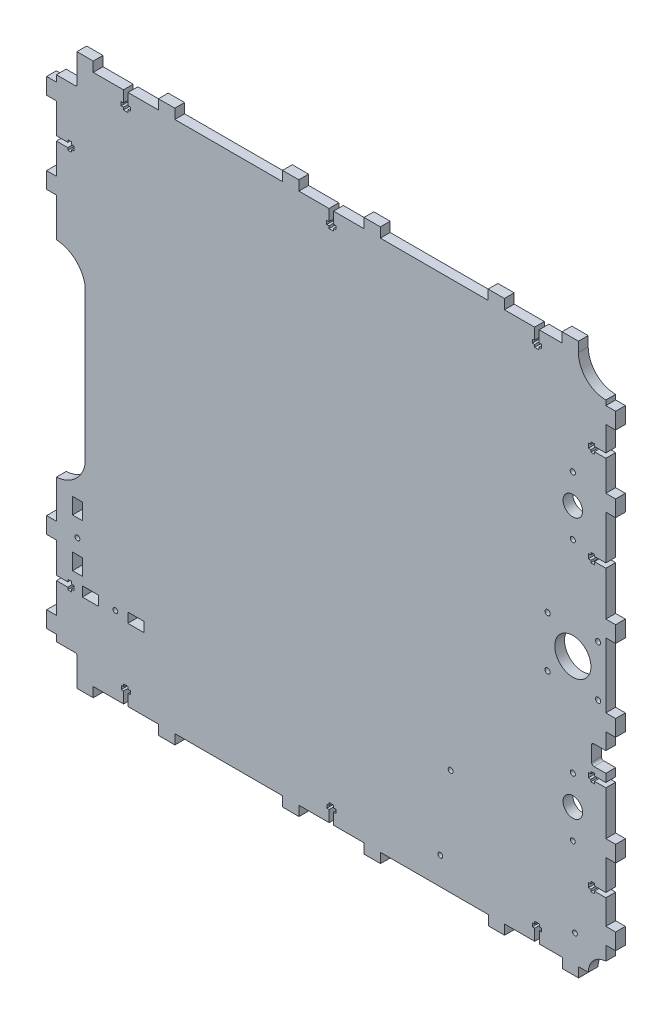
from build123d import *

# Parameters (mm, degrees)
SKETCH_1_R      = 6
SKETCH_1_R_2    = 1.6
SKETCH_1_R_3    = 1.55
SKETCH_1_R_4    = 11.1
SKETCH_1_R_5    = 1.5
SKETCH_1_W      = 9.9
SKETCH_1_H      = 6
SKETCH_1_W_2    = 6
SKETCH_1_H_2    = 9.9
EXTRUDE_1_DEPTH = 6


with BuildPart() as part:
    # Эскиз1 → Бобышка-Вытянуть1 (new body)
    with BuildSketch(Plane.XY):
        with BuildLine():
            Line((168.199310706, -52.298122462), (168.199310706, -57.218125343))
            Line((168.199310706, -57.218125343), (161.199309499, -57.218125343))
            Line((161.199309499, -57.218125343), (161.199309499, -55.815811247))
            Line((161.199309499, -55.815811247), (158.998486916, -55.815811247))
            Line((158.998486916, -55.815811247), (158.999308988, -57.215692211))
            Line((158.999308988, -57.215692211), (157.499309247, -57.216573077))
            Line((157.499309247, -57.216573077), (157.500952992, -60.015655883))
            Line((157.500952992, -60.015655883), (159.000952734, -60.014775017))
            Line((159.000952734, -60.014775017), (159.001775414, -61.415692272))
            Line((159.001775414, -61.415692272), (161.202727499, -61.415745636))
            Line((161.202727499, -61.415745636), (161.202286063, -60.018125343))
            Line((161.202286063, -60.018125343), (168.199310706, -60.018125343))
            Line((168.199310706, -60.018125343), (168.199310706, -87.018125343))
            Line((168.199310706, -87.018125343), (174.199310706, -87.018125343))
            Line((174.199310706, -87.018125343), (174.199310706, -97.018125338))
            Line((174.199310706, -97.018125338), (168.199310706, -97.018125338))
            Line((168.199310706, -97.018125338), (168.199310706, -115.618125338))
            Line((168.199310706, -115.618125338), (161.199752595, -115.618125338))
            Line((161.199752595, -115.618125338), (161.199752595, -114.216834131))
            Line((161.199752595, -114.216834131), (158.998486916, -114.216834131))
            Line((158.998486916, -114.216834131), (158.999308988, -115.616715096))
            Line((158.999308988, -115.616715096), (157.499309247, -115.617595962))
            Line((157.499309247, -115.617595962), (157.500952992, -118.416678768))
            Line((157.500952992, -118.416678768), (159.000952734, -118.415797902))
            Line((159.000952734, -118.415797902), (159.001775414, -119.816715157))
            Line((159.001775414, -119.816715157), (161.202113772, -119.816768506))
            Line((161.202113772, -119.816768506), (161.201876481, -118.418125338))
            Line((161.201876481, -118.418125338), (168.199310706, -118.418125338))
            Line((168.199310706, -118.418125338), (168.199310706, -133.598125338))
            Line((168.199310706, -133.598125338), (174.199310706, -133.598125338))
            Line((174.199310706, -133.598125338), (174.199310706, -143.598125338))
            Line((174.199310706, -143.598125338), (168.199310706, -143.598125338))
            Line((168.199310706, -143.598125338), (168.199310706, -152.12715677))
            ThreePointArc((168.199310706, -152.12715677), (160.572403694, -155.612835394), (157.456488656, -163.398125338))
            Line((157.456488656, -163.398125338), (151.456488656, -163.398125338))
            Line((151.456488656, -163.398125338), (151.472639331, -169.398125338))
            Line((151.472639331, -169.398125338), (141.464563993, -169.398125338))
            Line((141.464563993, -169.398125338), (141.464563993, -163.398125338))
            Line((141.464563993, -163.398125338), (127.366900433, -163.398125338))
            Line((127.366900433, -163.398125338), (127.365710498, -156.400624402))
            Line((127.365710498, -156.400624402), (128.765710498, -156.400590458))
            Line((128.765710498, -156.400590458), (128.765657157, -154.200590047))
            Line((128.765657157, -154.200590047), (127.364739902, -154.199767366))
            Line((127.364739902, -154.199767366), (127.365620769, -152.699767625))
            Line((127.365620769, -152.699767625), (124.566537963, -152.69812388))
            Line((124.566537963, -152.69812388), (124.565657096, -154.198123621))
            Line((124.565657096, -154.198123621), (123.165776132, -154.197301549))
            Line((123.165776132, -154.197301549), (123.165776132, -156.398124131))
            Line((123.165776132, -156.398124131), (124.565880156, -156.398124131))
            Line((124.565880156, -156.398124131), (124.565880156, -163.398125338))
            Line((124.565880156, -163.398125338), (106.088846345, -163.398125338))
            Line((106.088846345, -163.398125338), (106.088846345, -169.398125338))
            Line((106.088846345, -169.398125338), (96.088846345, -169.398125338))
            Line((96.088846345, -169.398125338), (96.088846345, -163.398125338))
            Line((96.088846345, -163.398125338), (30.000827623, -163.398125338))
            Line((30.000827623, -163.398125338), (30.000827623, -169.398125338))
            Line((30.000827623, -169.398125338), (20.000827623, -169.398125338))
            Line((20.000827623, -169.398125338), (20.000827623, -163.398125338))
            Line((20.000827623, -163.398125338), (1.304671492, -163.398125338))
            Line((1.304671492, -163.398125338), (1.303481557, -156.400624402))
            Line((1.303481557, -156.400624402), (2.703481557, -156.400590458))
            Line((2.703481557, -156.400590458), (2.703428216, -154.200590047))
            Line((2.703428216, -154.200590047), (1.302510961, -154.199767366))
            Line((1.302510961, -154.199767366), (1.303391828, -152.699767625))
            Line((1.303391828, -152.699767625), (-1.495690978, -152.69812388))
            Line((-1.495690978, -152.69812388), (-1.496571845, -154.198123621))
            Line((-1.496571845, -154.198123621), (-2.896452809, -154.197301549))
            Line((-2.896452809, -154.197301549), (-2.896452809, -156.398124131))
            Line((-2.896452809, -156.398124131), (-1.496348785, -156.398124131))
            Line((-1.496348785, -156.398124131), (-1.496348785, -163.398125338))
            Line((-1.496348785, -163.398125338), (-19.996163846, -163.398125338))
            Line((-19.996163846, -163.398125338), (-19.996163846, -169.398125338))
            Line((-19.996163846, -169.398125338), (-29.996163846, -169.398125338))
            Line((-29.996163846, -169.398125338), (-29.996163846, -163.398125338))
            Line((-29.996163846, -163.398125338), (-96.08209646, -163.398125338))
            Line((-96.08209646, -163.398125338), (-96.08209646, -169.398125338))
            Line((-96.08209646, -169.398125338), (-106.08209646, -169.398125338))
            Line((-106.08209646, -169.398125338), (-106.08209646, -163.398125338))
            Line((-106.08209646, -163.398125338), (-124.75810764, -163.398125338))
            Line((-124.75810764, -163.398125338), (-124.759297575, -156.400624402))
            Line((-124.759297575, -156.400624402), (-123.359297576, -156.400590458))
            Line((-123.359297576, -156.400590458), (-123.359350916, -154.200590047))
            Line((-123.359350916, -154.200590047), (-124.760268171, -154.199767366))
            Line((-124.760268171, -154.199767366), (-124.759387305, -152.699767625))
            Line((-124.759387305, -152.699767625), (-127.558470111, -152.69812388))
            Line((-127.558470111, -152.69812388), (-127.559350977, -154.198123621))
            Line((-127.559350977, -154.198123621), (-128.959231942, -154.197301549))
            Line((-128.959231942, -154.197301549), (-128.959231942, -156.398124131))
            Line((-128.959231942, -156.398124131), (-127.559127917, -156.398124131))
            Line((-127.559127917, -156.398124131), (-127.559127917, -163.398125338))
            Line((-127.559127917, -163.398125338), (-146.195092631, -163.398125338))
            Line((-146.195092631, -163.398125338), (-146.195092631, -169.398125338))
            Line((-146.195092631, -169.398125338), (-156.195092631, -169.398125338))
            Line((-156.195092631, -169.398125338), (-156.195092631, -151.950559202))
            ThreePointArc((-156.195092631, -151.950559202), (-156.443252823, -151.291213387), (-157.064566439, -150.959114341))
            Line((-157.064566439, -150.959114341), (-157.195092631, -150.950559202))
            Line((-157.195092631, -150.950559202), (-168.800689294, -150.950559202))
            Line((-168.800689294, -150.950559202), (-168.800689294, -146.938125338))
            Line((-168.800689294, -146.938125338), (-174.800689294, -146.938125338))
            Line((-174.800689294, -146.938125338), (-174.800689294, -136.938125338))
            Line((-174.800689294, -136.938125338), (-168.800689294, -136.938125338))
            Line((-168.800689294, -136.938125338), (-168.800689294, -118.438125338))
            Line((-168.800689294, -118.438125338), (-161.800688087, -118.438125338))
            Line((-161.800688087, -118.438125338), (-161.800688087, -119.838229363))
            Line((-161.800688087, -119.838229363), (-159.599865505, -119.838229363))
            Line((-159.599865505, -119.838229363), (-159.600686983, -118.439360374))
            Line((-159.600686983, -118.439360374), (-158.100196827, -118.43847922))
            Line((-158.100196827, -118.43847922), (-158.095498836, -115.637580558))
            Line((-158.095498836, -115.637580558), (-159.602331088, -115.638721675))
            Line((-159.602331088, -115.638721675), (-159.603391996, -114.237804581))
            Line((-159.603391996, -114.237804581), (-161.803392384, -114.238125353))
            Line((-161.803392384, -114.238125353), (-161.803188256, -115.638125338))
            Line((-161.803188256, -115.638125338), (-168.800689294, -115.638125338))
            Line((-168.800689294, -115.638125338), (-168.800689294, -96.918125338))
            Line((-168.800689294, -96.918125338), (-174.800689294, -96.918125338))
            Line((-174.800689294, -96.918125338), (-174.800689294, -86.918125338))
            Line((-174.800689294, -86.918125338), (-168.800689294, -86.918125338))
            Line((-168.800689294, -86.918125338), (-168.800689294, -63.480258903))
            ThreePointArc((-168.800689294, -63.480258903), (-157.388702527, -58.725695754), (-151.244839154, -47.997589884))
            Line((-151.244839154, -47.997589884), (-151.272354325, 47.500944109))
            ThreePointArc((-151.272354325, 47.500944109), (-157.419219349, 58.082787741), (-168.800689294, 62.579620646))
            Line((-168.800689294, 62.579620646), (-168.800689294, 86.321874662))
            Line((-168.800689294, 86.321874662), (-174.800689294, 86.321874662))
            Line((-174.800689294, 86.321874662), (-174.800689294, 96.321874662))
            Line((-174.800689294, 96.321874662), (-168.800689294, 96.321874662))
            Line((-168.800689294, 96.321874662), (-168.800689294, 115.041874662))
            Line((-168.800689294, 115.041874662), (-161.800688087, 115.041874662))
            Line((-161.800688087, 115.041874662), (-161.800688087, 113.641770637))
            Line((-161.800688087, 113.641770637), (-159.599865505, 113.641770637))
            Line((-159.599865505, 113.641770637), (-159.600687577, 115.041651602))
            Line((-159.600687577, 115.041651602), (-158.100210407, 115.042532748))
            Line((-158.100210407, 115.042532748), (-158.102330745, 117.842414269))
            Line((-158.102330745, 117.842414269), (-159.602331088, 117.841278325))
            Line((-159.602331088, 117.841278325), (-159.603391996, 119.242195419))
            Line((-159.603391996, 119.242195419), (-161.803392384, 119.241874647))
            Line((-161.803392384, 119.241874647), (-161.803188256, 117.841874662))
            Line((-161.803188256, 117.841874662), (-168.800689294, 117.841874662))
            Line((-168.800689294, 117.841874662), (-168.800689294, 136.341874662))
            Line((-168.800689294, 136.341874662), (-174.800689294, 136.341874662))
            Line((-174.800689294, 136.341874662), (-174.800689294, 146.341874662))
            Line((-174.800689294, 146.341874662), (-168.800689294, 146.341874662))
            Line((-168.800689294, 146.341874662), (-168.800689294, 150.22196022))
            Line((-168.800689294, 150.22196022), (-157.195092631, 150.22196022))
            ThreePointArc((-157.195092631, 150.22196022), (-156.48798585, 150.514853439), (-156.195092631, 151.22196022))
            Line((-156.195092631, 151.22196022), (-156.195092631, 168.801874662))
            Line((-156.195092631, 168.801874662), (-146.195092631, 168.801874662))
            Line((-146.195092631, 168.801874662), (-146.195092631, 162.801874662))
            Line((-146.195092631, 162.801874662), (-127.654444614, 162.801874662))
            Line((-127.654444614, 162.801874662), (-127.654444614, 155.801873455))
            Line((-127.654444614, 155.801873455), (-129.054548638, 155.801873455))
            Line((-129.054548638, 155.801873455), (-129.054548638, 153.601050872))
            Line((-129.054548638, 153.601050872), (-127.654667673, 153.601872944))
            Line((-127.654667673, 153.601872944), (-127.653786807, 152.101873203))
            Line((-127.653786807, 152.101873203), (-124.854704001, 152.103516948))
            Line((-124.854704001, 152.103516948), (-124.855584867, 153.60351669))
            Line((-124.855584867, 153.60351669), (-123.454667612, 153.60433937))
            Line((-123.454667612, 153.60433937), (-123.454614272, 155.804339781))
            Line((-123.454614272, 155.804339781), (-124.854614272, 155.804373725))
            Line((-124.854614272, 155.804373725), (-124.853424337, 162.801874662))
            Line((-124.853424337, 162.801874662), (-106.177413157, 162.801874662))
            Line((-106.177413157, 162.801874662), (-106.177413157, 168.801874662))
            Line((-106.177413157, 168.801874662), (-96.177413157, 168.801874662))
            Line((-96.177413157, 168.801874662), (-96.177413157, 162.801874662))
            Line((-96.177413157, 162.801874662), (-30.091480542, 162.801874662))
            Line((-30.091480542, 162.801874662), (-30.091480542, 168.801874662))
            Line((-30.091480542, 168.801874662), (-20.091480542, 168.801874662))
            Line((-20.091480542, 168.801874662), (-20.091480542, 162.801874662))
            Line((-20.091480542, 162.801874662), (-1.591665481, 162.801874662))
            Line((-1.591665481, 162.801874662), (-1.591665481, 155.801873455))
            Line((-1.591665481, 155.801873455), (-2.991769506, 155.801873455))
            Line((-2.991769506, 155.801873455), (-2.991769506, 153.601050872))
            Line((-2.991769506, 153.601050872), (-1.591888541, 153.601872944))
            Line((-1.591888541, 153.601872944), (-1.591007675, 152.101873203))
            Line((-1.591007675, 152.101873203), (1.208075131, 152.103516948))
            Line((1.208075131, 152.103516948), (1.207194265, 153.60351669))
            Line((1.207194265, 153.60351669), (2.60811152, 153.60433937))
            Line((2.60811152, 153.60433937), (2.60816486, 155.804339781))
            Line((2.60816486, 155.804339781), (1.208164861, 155.804373725))
            Line((1.208164861, 155.804373725), (1.209354796, 162.801874662))
            Line((1.209354796, 162.801874662), (19.905510926, 162.801874662))
            Line((19.905510926, 162.801874662), (19.905510926, 168.801874662))
            Line((19.905510926, 168.801874662), (29.905510926, 168.801874662))
            Line((29.905510926, 168.801874662), (29.905510926, 162.801874662))
            Line((29.905510926, 162.801874662), (95.993529648, 162.801874662))
            Line((95.993529648, 162.801874662), (95.993529648, 168.801874662))
            Line((95.993529648, 168.801874662), (105.993529648, 168.801874662))
            Line((105.993529648, 168.801874662), (105.993529648, 162.801874662))
            Line((105.993529648, 162.801874662), (124.47056346, 162.801874662))
            Line((124.47056346, 162.801874662), (124.47056346, 155.801873455))
            Line((124.47056346, 155.801873455), (123.070459435, 155.801873455))
            Line((123.070459435, 155.801873455), (123.070459435, 153.601050872))
            Line((123.070459435, 153.601050872), (124.4703404, 153.601872944))
            Line((124.4703404, 153.601872944), (124.471221266, 152.101873203))
            Line((124.471221266, 152.101873203), (127.270304072, 152.103516948))
            Line((127.270304072, 152.103516948), (127.269423206, 153.60351669))
            Line((127.269423206, 153.60351669), (128.670340461, 153.60433937))
            Line((128.670340461, 153.60433937), (128.670393801, 155.804339781))
            Line((128.670393801, 155.804339781), (127.270393802, 155.804373725))
            Line((127.270393802, 155.804373725), (127.271583737, 162.801874662))
            Line((127.271583737, 162.801874662), (141.377322634, 162.801874662))
            Line((141.377322634, 162.801874662), (141.377322634, 168.801874662))
            Line((141.377322634, 168.801874662), (151.377322634, 168.801874662))
            Line((151.377322634, 168.801874662), (151.377322634, 162.801874662))
            ThreePointArc((151.377322634, 162.801874662), (156.304368867, 150.906932823), (168.199310706, 145.97988659))
            Line((168.199310706, 145.97988659), (168.199310706, 143.001874662))
            Line((168.199310706, 143.001874662), (174.199310706, 143.001874662))
            Line((174.199310706, 143.001874662), (174.199310706, 133.001874662))
            Line((174.199310706, 133.001874662), (168.199310706, 133.001874662))
            Line((168.199310706, 133.001874662), (168.199310706, 117.821874662))
            Line((168.199310706, 117.821874662), (161.198884876, 117.821874662))
            Line((161.198884876, 117.821874662), (161.198672593, 119.221937544))
            Line((161.198672593, 119.221937544), (158.997850029, 119.221603845))
            Line((158.997850029, 119.221603845), (158.998884357, 117.821723022))
            Line((158.998884357, 117.821723022), (157.498884767, 117.820614719))
            Line((157.498884767, 117.820614719), (157.500952921, 115.021532194))
            Line((157.500952921, 115.021532194), (159.000952512, 115.022640497))
            Line((159.000952512, 115.022640497), (159.001987605, 113.621723383))
            Line((159.001987605, 113.621723383), (161.202013777, 113.622003619))
            Line((161.202013777, 113.622003619), (161.201809668, 115.021874662))
            Line((161.201809668, 115.021874662), (168.199310706, 115.021874662))
            Line((168.199310706, 115.021874662), (168.199310706, 96.421874662))
            Line((168.199310706, 96.421874662), (174.199310706, 96.421874662))
            Line((174.199310706, 96.421874662), (174.199310706, 86.421874662))
            Line((174.199310706, 86.421874662), (168.199310706, 86.421874662))
            Line((168.199310706, 86.421874662), (168.199310706, 59.421874662))
            Line((168.199310706, 59.421874662), (161.199309232, 59.421874662))
            Line((161.199309232, 59.421874662), (161.199309232, 60.476838077))
            Line((161.199309232, 60.476838077), (158.998486738, 60.476838077))
            Line((158.998486738, 60.476838077), (158.99930881, 59.076957113))
            Line((158.99930881, 59.076957113), (157.499309069, 59.076076247))
            Line((157.499309069, 59.076076247), (157.500952814, 56.276993441))
            Line((157.500952814, 56.276993441), (159.000952556, 56.277874307))
            Line((159.000952556, 56.277874307), (159.001775236, 54.876957052))
            Line((159.001775236, 54.876957052), (161.202064095, 54.876903704))
            Line((161.202064095, 54.876903704), (161.201809668, 56.621874662))
            Line((161.201809668, 56.621874662), (168.199310706, 56.621874662))
            Line((168.199310706, 56.621874662), (168.199310706, 29.621874662))
            Line((168.199310706, 29.621874662), (174.199310706, 29.621874662))
            Line((174.199310706, 29.621874662), (174.199310706, 19.621874662))
            Line((174.199310706, 19.621874662), (168.199310706, 19.621874662))
            Line((168.199310706, 19.621874662), (168.199310706, -20.218125343))
            Line((168.199310706, -20.218125343), (174.199310706, -20.218125343))
            Line((174.199310706, -20.218125343), (174.199310706, -30.218125343))
            Line((174.199310706, -30.218125343), (168.199310706, -30.218125343))
            Line((168.199310706, -30.218125343), (168.199310706, -40.298068824))
            Line((168.199310706, -40.298068824), (160.899314476, -40.305488615))
            ThreePointArc((160.899314476, -40.305488615), (159.839101402, -40.745906282), (159.400839866, -41.807012455))
            Line((159.400839866, -41.807012455), (159.409987554, -50.807007806))
            ThreePointArc((159.409987554, -50.807007806), (159.866776617, -51.884084101), (160.958185364, -52.305482417))
            Line((160.958185364, -52.305482417), (168.199310706, -52.298122462))
        make_face()
        with Locations((147.949520288, -80.298125338)):
            Circle(SKETCH_1_R, mode=Mode.SUBTRACT)
        with Locations((132.449520287, 15.201874662)):
            Circle(SKETCH_1_R_2, mode=Mode.SUBTRACT)
        with Locations((147.949520287, 61.701874662)):
            Circle(SKETCH_1_R_3, mode=Mode.SUBTRACT)
        with Locations((163.449520287, 15.201874662)):
            Circle(SKETCH_1_R_2, mode=Mode.SUBTRACT)
        with Locations((147.949520288, -62.298125338)):
            Circle(SKETCH_1_R_3, mode=Mode.SUBTRACT)
        with Locations((163.449520287, -15.798125338)):
            Circle(SKETCH_1_R_2, mode=Mode.SUBTRACT)
        with Locations((132.449520287, -15.798125338)):
            Circle(SKETCH_1_R_2, mode=Mode.SUBTRACT)
        with Locations((147.949520287, -0.298125338)):
            Circle(SKETCH_1_R_4, mode=Mode.SUBTRACT)
        with Locations((147.949520287, 97.701874662)):
            Circle(SKETCH_1_R_2, mode=Mode.SUBTRACT)
        with Locations((147.949520287, 79.701874662)):
            Circle(SKETCH_1_R, mode=Mode.SUBTRACT)
        with Locations((-132.646005991, -116.230657757)):
            Circle(SKETCH_1_R_5, mode=Mode.SUBTRACT)
        with Locations((-155.896005991, -89.303657757)):
            Circle(SKETCH_1_R_5, mode=Mode.SUBTRACT)
        with Locations((73.019520288, -98.298125338)):
            Circle(SKETCH_1_R_5, mode=Mode.SUBTRACT)
        with Locations((66.669520288, -146.558125338)):
            Circle(SKETCH_1_R_5, mode=Mode.SUBTRACT)
        with Locations((149.249520288, -146.558125338)):
            Circle(SKETCH_1_R_5, mode=Mode.SUBTRACT)
        with Locations((147.949520288, -98.298125338)):
            Circle(SKETCH_1_R_5, mode=Mode.SUBTRACT)
        with Locations((-120.044005991, -116.230657757)):
            Rectangle(SKETCH_1_W, SKETCH_1_H, mode=Mode.SUBTRACT)
        with Locations((-147.946005991, -116.230657757)):
            Rectangle(SKETCH_1_W, SKETCH_1_H, mode=Mode.SUBTRACT)
        with Locations((-155.896005991, -73.691657757)):
            Rectangle(SKETCH_1_W_2, SKETCH_1_H_2, mode=Mode.SUBTRACT)
        with Locations((-155.896005991, -103.280657757)):
            Rectangle(SKETCH_1_W_2, SKETCH_1_H_2, mode=Mode.SUBTRACT)
    extrude(amount=EXTRUDE_1_DEPTH)


solid = part.part
